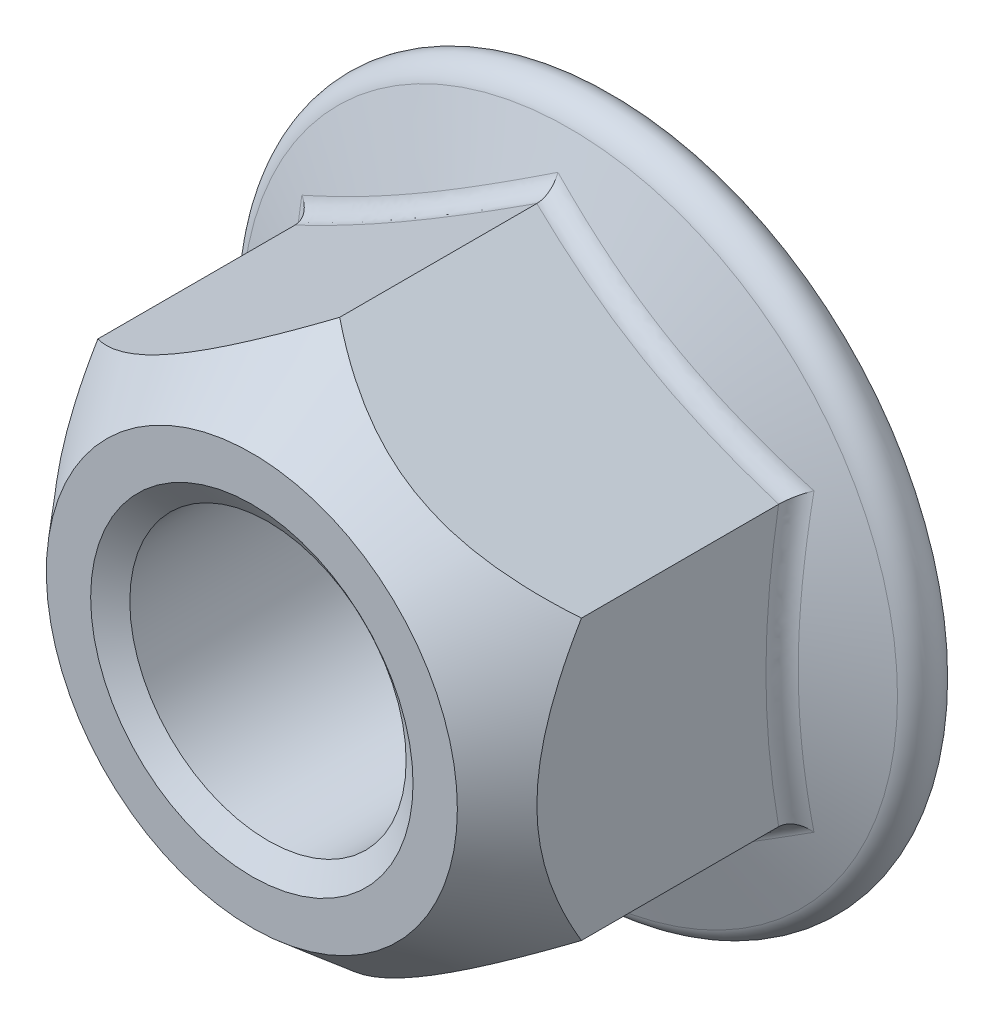
from build123d import *

# Parameters (mm, degrees)
THREADSCHEMATIC_START     = -15.9
THREADSCHEMATIC_OUTLINE_R = 6
THREADSCHEMATIC_DEPTH     = 15.9
FLANGEFILLET_R            = 0.88


# Read off the part's stored shape, not the designer's step: ThreadSchematic
with BuildPart() as part:
    # ThreadSchematic outline → ThreadSchematic (new body)
    with BuildSketch(Plane.XY.offset(THREADSCHEMATIC_START)):
        Polygon((10.5, 6.062177826), (0, 12.124355653), (-10.5, 6.062177826), (-10.5, -6.062177826), (0, -12.124355653), (10.5, -6.062177826), align=None)
        Circle(THREADSCHEMATIC_OUTLINE_R, mode=Mode.SUBTRACT)
    extrude(amount=THREADSCHEMATIC_DEPTH)

    # Sketch6 → Flange (revolve)
    with BuildSketch(Plane(origin=(0, 0, 0), x_dir=(0, 0, -1), z_dir=(1, 0, 0)), mode=Mode.PRIVATE) as flange_sk:
        with BuildLine():
            Line((10.801743914, 6), (13.8, 14.237640895))
            ThreePointArc((13.8, 14.237640895), (15.0053537, 14.933552178), (15.9, 13.867354236))
            Line((15.9, 13.867354236), (15.9, 6))
            Line((15.9, 6), (10.801743914, 6))
        make_face()
    revolve(flange_sk.sketch.rotate(Axis((0, 0, 0), (0, 0, -1)), 90), axis=Axis((0, 0, 0), (0, 0, -1)))

    # Sketch3 → Double-Chamfer (revolve, cut)
    with BuildSketch(Plane(origin=(0, 0, 0), x_dir=(0, 0, -1), z_dir=(1, 0, 0)), mode=Mode.PRIVATE) as double_chamfer_sk:
        Polygon((3.812843593, 24.824355653), (-12.7, 24.824355653), (-12.7, 8.925), (0, 8.925), (3.812843593, 12.124355653), align=None)
    revolve(double_chamfer_sk.sketch.rotate(Axis((0, 0, 0), (0, 0, -1)), 300.000000044), axis=Axis((0, 0, 0), (0, 0, -1)), mode=Mode.SUBTRACT)

    # FlangeFillet
    flangefillet_edges = [part.edges().sort_by_distance(p)[0] for p in [
        (10.5, 3.044311508, -12.596998401),
        (5.25, 9.09326674, -12.439609968),
        (-5.25, 9.09326674, -12.439609968),
        (-10.5, 0, -12.439609968),
        (-5.25, -9.09326674, -12.439609968),
        (5.25, -9.09326674, -12.439609968),
        (10.5, -3.044311508, -12.596998401),
    ]]
    fillet(flangefillet_edges, radius=FLANGEFILLET_R)

    # Sketch5 → EndChamfer (revolve, cut)
    with BuildSketch(Plane(origin=(0, 0, 0), x_dir=(0, 0, -1), z_dir=(1, 0, 0)), mode=Mode.PRIVATE) as endchamfer_sk:
        Polygon((15.8746, 7), (15.104371708, 5.9), (15.9254, 5.9), (15.9254, 7), align=None)
        Polygon((-0.0508, 7), (0, 7), (0.770228292, 5.9), (-0.0508, 5.9), align=None)
    revolve(endchamfer_sk.sketch.rotate(Axis((0, 0, -25.037505729), (0, 0, -1)), 90), axis=Axis((0, 0, -25.037505729), (0, 0, -1)), mode=Mode.SUBTRACT)


solid = part.part
